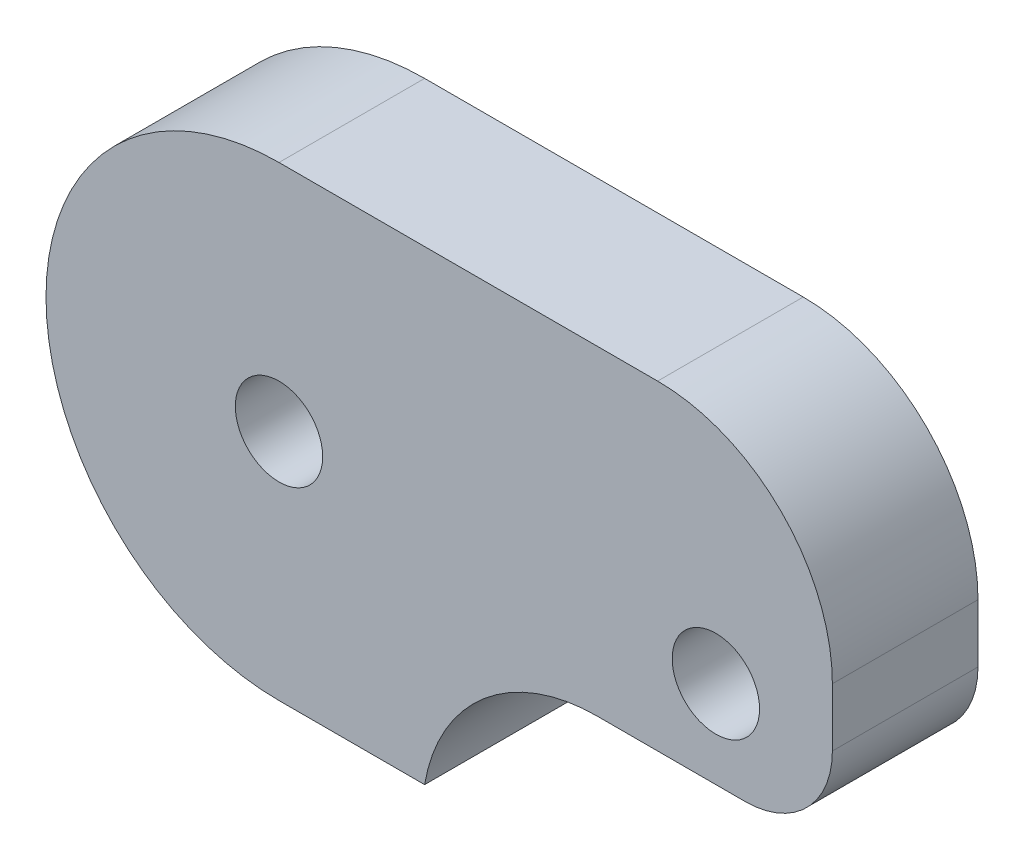
from build123d import *

# Parameters (mm, degrees)
ESQUISSE1_R        = 1.5
BOSS_EXTRU_1_DEPTH = 5
CONG_1_R           = 6
CONG_2_R           = 3


with BuildPart() as part:
    # Esquisse1 → Boss.-Extru.1 (new body)
    with BuildSketch(Plane.XY):
        with BuildLine():
            Line((20, -3), (34, -3))
            Line((34, -3), (34, 8))
            Line((34, 8), (15, 8))
            ThreePointArc((15, 8), (7, 0), (15, -8))
            Line((15, -8), (20, -8))
            Line((20, -8), (20, -3))
        make_face()
        with Locations((15, 0)):
            Circle(ESQUISSE1_R, mode=Mode.SUBTRACT)
        with Locations((30, 0)):
            Circle(ESQUISSE1_R, mode=Mode.SUBTRACT)
    extrude(amount=BOSS_EXTRU_1_DEPTH)

    # Congé1
    # the kernel refuses this fillet: 6 mm, written as the material it adds along each edge
    with BuildSketch(Plane(origin=(20, -3, 0), x_dir=(-2.958065230920737e-05, -0.9999999995624925, 0), z_dir=(0, 0, 1))) as cong_1_piece_1:
        with BuildLine():
            CenterArc((5.999675, 5.916130485), CONG_1_R, 180.001694847, 80.407142396)
            Line((-0.000324998, 5.915953002), (-0.120324998, 5.915949452))
            ThreePointArc((-0.120324998, 5.915949452), (-0.120087499, 2.957972953), (-0.12, -3.55e-06))
            Line((-0.12, -3.55e-06), (3.55e-06, -0.12))
            ThreePointArc((3.55e-06, -0.12), (2.49999105, -0.119926049), (4.979981005, -0.11832261))
            Line((4.979981005, -0.11832261), (4.999975005, 0))
        make_face()
    extrude(amount=5)
    # the kernel refuses this fillet: 6 mm, written as the material it takes off along each edge
    with BuildSketch(Plane(origin=(34, 8, -14.999625005), x_dir=(-0.9999999996874845, 2.500062500775405e-05, 0), z_dir=(0, 0, 1))) as cong_1_2_piece_1:
        with BuildLine():
            CenterArc((5.999699998, 5.999999998), CONG_1_R, 180.00143243, 90)
            Line((-0.0003, 5.999849994), (-0.1203, 5.999846994))
            ThreePointArc((-0.1203, 5.999846994), (-0.120075, 2.999921999), (-0.12, -3e-06))
            Line((-0.12, -3e-06), (3e-06, -0.12))
            ThreePointArc((3e-06, -0.12), (2.999927999, -0.119925), (5.999853002, -0.12))
            Line((5.999853002, -0.12), (5.999850002, 0))
        make_face()
    extrude(amount=34.999250009, mode=Mode.SUBTRACT)
    with BuildSketch(Plane(origin=(20, -22.789882526, 5), x_dir=(2.9580652309207366e-05, 0, -0.9999999995624925), z_dir=(0, 1, 0))) as cong_1_2_piece_2:
        with BuildLine():
            CenterArc((5.999675, 5.916130485), CONG_1_R, 180.001694847, 80.407142396)
            Line((-0.000324998, 5.915953002), (-0.120324998, 5.915949452))
            ThreePointArc((-0.120324998, 5.915949452), (-0.120087499, 2.957972953), (-0.12, -3.55e-06))
            Line((-0.12, -3.55e-06), (3.55e-06, -0.12))
            ThreePointArc((3.55e-06, -0.12), (2.49999105, -0.119926049), (4.979981005, -0.11832261))
            Line((4.979981005, -0.11832261), (4.999975005, 0))
        make_face()
    extrude(amount=29.580664771, mode=Mode.SUBTRACT)
    with BuildSketch(Plane(origin=(20, -22.789882526, 0), x_dir=(2.9580652309207366e-05, 0, 0.9999999995624925), z_dir=(0, 1, 0))) as cong_1_2_piece_3:
        with BuildLine():
            CenterArc((5.999675, -5.916130485), CONG_1_R, 99.591162758, 80.407142396)
            Line((-0.000324998, -5.915953002), (-0.120324998, -5.915949452))
            ThreePointArc((-0.120324998, -5.915949452), (-0.120087499, -2.957972953), (-0.12, 3.55e-06))
            Line((-0.12, 3.55e-06), (3.55e-06, 0.12))
            ThreePointArc((3.55e-06, 0.12), (2.49999105, 0.119926049), (4.979981005, 0.11832261))
            Line((4.979981005, 0.11832261), (4.999975005, 0))
        make_face()
    extrude(amount=29.580664771, mode=Mode.SUBTRACT)

    # Congé2
    cong_2_edges = [part.edges().sort_by_distance(p)[0] for p in [
        (34, -3, 2.5),
    ]]
    fillet(cong_2_edges, radius=CONG_2_R)


solid = part.part
